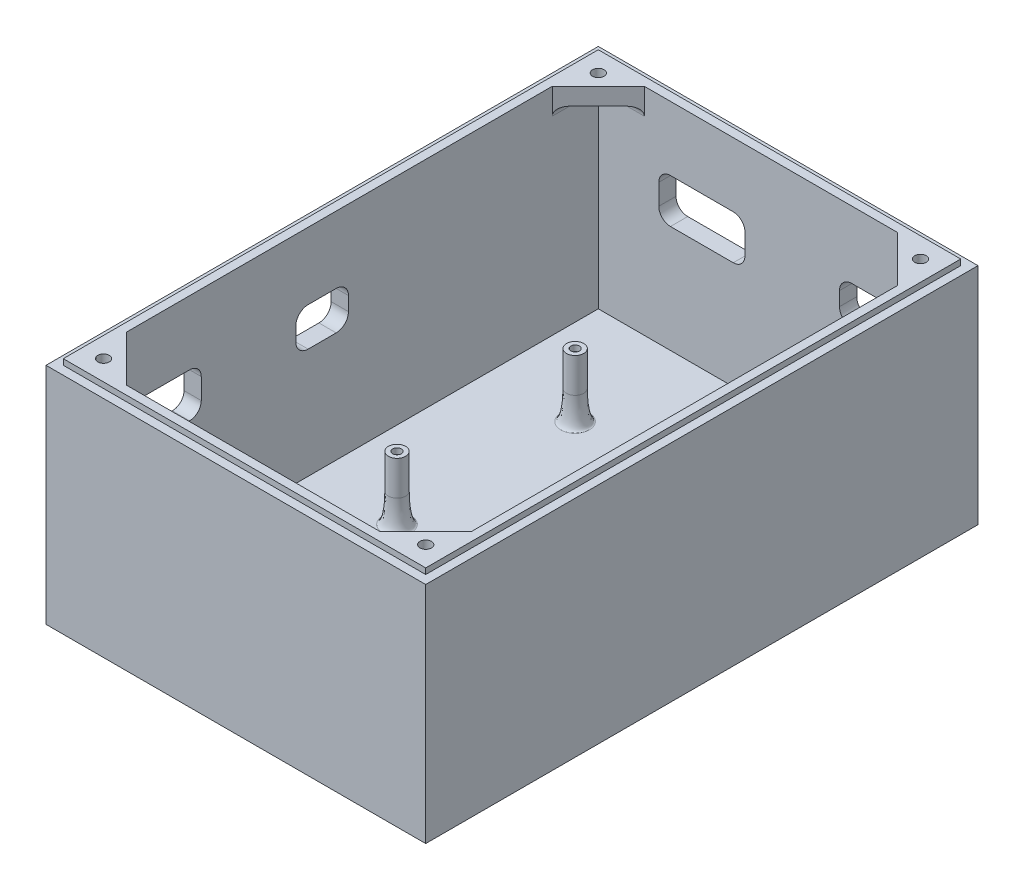
from build123d import *

# Parameters (mm, degrees)
SKETCH1_W           = 132
SKETCH1_H           = 192
SKETCH1_W_2         = 120
SKETCH1_H_2         = 180
BOSS_EXTRUDE1_DEPTH = 80
SKETCH2_W           = 132
SKETCH2_H           = 192
BOSS_EXTRUDE2_DEPTH = 5
CUT_EXTRUDE1_DEPTH  = 6
CUT_EXTRUDE2_DEPTH  = 6
BOSS_EXTRUDE3_DEPTH = 22
FILLET2_SIZE        = 2
FILLET2_SIZE_2      = 10
SKETCH7_W           = 8
SKETCH7_H           = 8
SKETCH7_R           = 2
BOSS_EXTRUDE4_DEPTH = 6
SKETCH9_W           = 132
SKETCH9_H           = 192
SKETCH9_W_2         = 126
SKETCH9_H_2         = 186
CUT_EXTRUDE3_DEPTH  = 2
FILLET5_R           = 3
SKETCH10_R          = 1.5
CUT_EXTRUDE4_DEPTH  = 2


with BuildPart() as part:
    # Sketch1 → Boss-Extrude1 (new body)
    with BuildSketch(Plane(origin=(0, 0, 0), x_dir=(1, 0, 0), z_dir=(0, 1, 0))):
        Rectangle(SKETCH1_W, SKETCH1_H)
        Rectangle(SKETCH1_W_2, SKETCH1_H_2, mode=Mode.SUBTRACT)
    extrude(amount=BOSS_EXTRUDE1_DEPTH)

    # Sketch2 → Boss-Extrude2 (add)
    with BuildSketch(Plane(origin=(0, 0, 0), x_dir=(-1, 0, 0), z_dir=(0, -1, 0))):
        Rectangle(SKETCH2_W, SKETCH2_H)
    extrude(amount=-BOSS_EXTRUDE2_DEPTH)

    # Sketch3 → Cut-Extrude1 (cut)
    with BuildSketch(Plane(origin=(0, 0, -96), x_dir=(-1, 0, 0), z_dir=(0, 0, -1))):
        with BuildLine():
            Line((-37.875, 56.69), (-28.125, 56.69))
            ThreePointArc((-28.125, 56.69), (-25.105654044, 55.439345956), (-23.855, 52.42))
            Line((-23.855, 52.42), (-23.855, 47.58))
            ThreePointArc((-23.855, 47.58), (-25.105654044, 44.560654044), (-28.125, 43.31))
            Line((-28.125, 43.31), (-37.875, 43.31))
            ThreePointArc((-37.875, 43.31), (-40.894345956, 44.560654044), (-42.145, 47.58))
            Line((-42.145, 47.58), (-42.145, 52.42))
            ThreePointArc((-42.145, 52.42), (-40.894345956, 55.439345956), (-37.875, 56.69))
        make_face()
        with BuildLine():
            Line((13.085, 57.67), (34.915, 57.67))
            ThreePointArc((34.915, 57.67), (37.785853532, 56.480853532), (38.975, 53.61))
            Line((38.975, 53.61), (38.975, 46.39))
            ThreePointArc((38.975, 46.39), (37.785853532, 43.519146468), (34.915, 42.33))
            Line((34.915, 42.33), (13.085, 42.33))
            ThreePointArc((13.085, 42.33), (10.214146468, 43.519146468), (9.025, 46.39))
            Line((9.025, 46.39), (9.025, 53.61))
            ThreePointArc((9.025, 53.61), (10.214146468, 56.480853532), (13.085, 57.67))
        make_face()
    extrude(amount=-CUT_EXTRUDE1_DEPTH, mode=Mode.SUBTRACT)

    # Sketch4 → Cut-Extrude2 (cut)
    with BuildSketch(Plane.ZY.offset(66)):
        with BuildLine():
            Line((52.085, 57.67), (73.915, 57.67))
            ThreePointArc((73.915, 57.67), (76.785853532, 56.480853532), (77.975, 53.61))
            Line((77.975, 53.61), (77.975, 46.39))
            ThreePointArc((77.975, 46.39), (76.785853532, 43.519146468), (73.915, 42.33))
            Line((73.915, 42.33), (52.085, 42.33))
            ThreePointArc((52.085, 42.33), (49.214146468, 43.519146468), (48.025, 46.39))
            Line((48.025, 46.39), (48.025, 53.61))
            ThreePointArc((48.025, 53.61), (49.214146468, 56.480853532), (52.085, 57.67))
        make_face()
        with BuildLine():
            Line((1.125, 56.69), (10.875, 56.69))
            ThreePointArc((10.875, 56.69), (13.894345956, 55.439345956), (15.145, 52.42))
            Line((15.145, 52.42), (15.145, 47.58))
            ThreePointArc((15.145, 47.58), (13.894345956, 44.560654044), (10.875, 43.31))
            Line((10.875, 43.31), (1.125, 43.31))
            ThreePointArc((1.125, 43.31), (-1.894345956, 44.560654044), (-3.145, 47.58))
            Line((-3.145, 47.58), (-3.145, 52.42))
            ThreePointArc((-3.145, 52.42), (-1.894345956, 55.439345956), (1.125, 56.69))
        make_face()
    extrude(amount=-CUT_EXTRUDE2_DEPTH, mode=Mode.SUBTRACT)

    # Sketch5 → Boss-Extrude3 (add)
    with BuildSketch(Plane(origin=(0, 5, 0), x_dir=(1, 0, 0), z_dir=(0, 1, 0))):
        with BuildLine():
            ThreePointArc((45.046999695, 52.032000671), (42.046999695, 55.032000671), (39.046999695, 52.032000671))
            Line((39.046999695, 52.032000671), (42.046999695, 52.032000671))
            Line((42.046999695, 52.032000671), (42.046999695, 49.032000671))
            ThreePointArc((42.046999695, 49.032000671), (44.168320038, 49.910680328), (45.046999695, 52.032000671))
        make_face()
        with BuildLine():
            Line((42.046999695, 52.032000671), (39.046999695, 52.032000671))
            ThreePointArc((39.046999695, 52.032000671), (39.925679351, 49.910680328), (42.046999695, 49.032000671))
            Line((42.046999695, 49.032000671), (42.046999695, 52.032000671))
        make_face()
        with BuildLine():
            ThreePointArc((45.046999695, -71.793003906), (44.168320038, -69.671683563), (42.046999695, -68.793003906))
            Line((42.046999695, -68.793003906), (42.046999695, -71.793003906))
            Line((42.046999695, -71.793003906), (39.046999695, -71.793003906))
            ThreePointArc((39.046999695, -71.793003906), (42.046999695, -74.793003906), (45.046999695, -71.793003906))
        make_face()
        with BuildLine():
            Line((42.046999695, -71.793003906), (42.046999695, -68.793003906))
            ThreePointArc((42.046999695, -68.793003906), (39.925679351, -69.671683563), (39.046999695, -71.793003906))
            Line((39.046999695, -71.793003906), (42.046999695, -71.793003906))
        make_face()
        with BuildLine():
            Line((-30.089001892, 49.032000671), (-30.089001892, 52.032000671))
            Line((-30.089001892, 52.032000671), (-27.089001892, 52.032000671))
            ThreePointArc((-27.089001892, 52.032000671), (-32.210322236, 54.153321015), (-30.089001892, 49.032000671))
        make_face()
        with BuildLine():
            Line((-27.089001892, 52.032000671), (-30.089001892, 52.032000671))
            Line((-30.089001892, 52.032000671), (-30.089001892, 49.032000671))
            ThreePointArc((-30.089001892, 49.032000671), (-27.967681549, 49.910680328), (-27.089001892, 52.032000671))
        make_face()
        with BuildLine():
            ThreePointArc((-27.089001892, -71.793003906), (-27.967681549, -69.671683563), (-30.089001892, -68.793003906))
            Line((-30.089001892, -68.793003906), (-30.089001892, -71.793003906))
            Line((-30.089001892, -71.793003906), (-27.089001892, -71.793003906))
        make_face()
        with BuildLine():
            Line((-30.089001892, -71.793003906), (-30.089001892, -68.793003906))
            ThreePointArc((-30.089001892, -68.793003906), (-32.210322236, -73.91432425), (-27.089001892, -71.793003906))
            Line((-27.089001892, -71.793003906), (-30.089001892, -71.793003906))
        make_face()
        with BuildLine():
            ThreePointArc((-27.089001892, -9.880501617), (-27.967681549, -7.759181274), (-30.089001892, -6.880501617))
            Line((-30.089001892, -6.880501617), (-30.089001892, -12.880501617))
            ThreePointArc((-30.089001892, -12.880501617), (-27.967681549, -12.001821961), (-27.089001892, -9.880501617))
        make_face()
        with BuildLine():
            Line((-30.089001892, -12.880501617), (-30.089001892, -6.880501617))
            ThreePointArc((-30.089001892, -6.880501617), (-33.089001892, -9.880501617), (-30.089001892, -12.880501617))
        make_face()
        with BuildLine():
            ThreePointArc((45.046999695, -9.880501617), (44.168320038, -7.759181274), (42.046999695, -6.880501617))
            Line((42.046999695, -6.880501617), (42.046999695, -12.880501617))
            ThreePointArc((42.046999695, -12.880501617), (44.168320038, -12.001821961), (45.046999695, -9.880501617))
        make_face()
        with BuildLine():
            Line((42.046999695, -12.880501617), (42.046999695, -6.880501617))
            ThreePointArc((42.046999695, -6.880501617), (39.046999695, -9.880501617), (42.046999695, -12.880501617))
        make_face()
    extrude(amount=BOSS_EXTRUDE3_DEPTH)

    # Fillet2
    # an asymmetric fillet: 10, 2 mm, written as the material it adds along each edge
    with BuildSketch(Plane(origin=(42.046999695, 5, -52.032000671), x_dir=(-1, 0, 0), z_dir=(0, 0, -1))) as fillet2_piece_1:
        with BuildLine():
            Bezier((3 + FILLET2_SIZE, 0), (3, 0), (3, FILLET2_SIZE_2), weights=[1, 0.707106781, 1])
            Line((3, FILLET2_SIZE_2), (3, 0))
            Line((3, 0), (3 + FILLET2_SIZE, 0))
        make_face()
    revolve(axis=Axis((42.046999695, 5, -52.032000671), (0, 1, 0)))
    with BuildSketch(Plane(origin=(42.046999695, 5, 71.793003906), x_dir=(0, 0, -1), z_dir=(1, 0, 0))) as fillet2_piece_2:
        with BuildLine():
            Bezier((3 + FILLET2_SIZE, 0), (3, 0), (3, FILLET2_SIZE_2), weights=[1, 0.707106781, 1])
            Line((3, FILLET2_SIZE_2), (3, 0))
            Line((3, 0), (3 + FILLET2_SIZE, 0))
        make_face()
    revolve(axis=Axis((42.046999695, 5, 71.793003906), (0, 1, 0)))
    with BuildSketch(Plane(origin=(-30.089001892, 5, -52.032000671), x_dir=(0, 0, 1), z_dir=(-1, 0, 0))) as fillet2_piece_3:
        with BuildLine():
            Bezier((3 + FILLET2_SIZE, 0), (3, 0), (3, FILLET2_SIZE_2), weights=[1, 0.707106781, 1])
            Line((3, FILLET2_SIZE_2), (3, 0))
            Line((3, 0), (3 + FILLET2_SIZE, 0))
        make_face()
    revolve(axis=Axis((-30.089001892, 5, -52.032000671), (0, 1, 0)))
    with BuildSketch(Plane(origin=(-30.089001892, 5, 71.793003906), x_dir=(1, 0, 0), z_dir=(0, 0, 1))) as fillet2_piece_4:
        with BuildLine():
            Bezier((3 + FILLET2_SIZE, 0), (3, 0), (3, FILLET2_SIZE_2), weights=[1, 0.707106781, 1])
            Line((3, FILLET2_SIZE_2), (3, 0))
            Line((3, 0), (3 + FILLET2_SIZE, 0))
        make_face()
    revolve(axis=Axis((-30.089001892, 5, 71.793003906), (0, 1, 0)))
    with BuildSketch(Plane(origin=(-30.089001892, 5, 9.880501617), x_dir=(0, 0, -1), z_dir=(1, 0, 0))) as fillet2_piece_5:
        with BuildLine():
            Bezier((3 + FILLET2_SIZE, 0), (3, 0), (3, FILLET2_SIZE_2), weights=[1, 0.707106781, 1])
            Line((3, FILLET2_SIZE_2), (3, 0))
            Line((3, 0), (3 + FILLET2_SIZE, 0))
        make_face()
    revolve(axis=Axis((-30.089001892, 5, 9.880501617), (0, 1, 0)))
    with BuildSketch(Plane(origin=(42.046999695, 5, 9.880501617), x_dir=(0, 0, -1), z_dir=(1, 0, 0))) as fillet2_piece_6:
        with BuildLine():
            Bezier((3 + FILLET2_SIZE, 0), (3, 0), (3, FILLET2_SIZE_2), weights=[1, 0.707106781, 1])
            Line((3, FILLET2_SIZE_2), (3, 0))
            Line((3, 0), (3 + FILLET2_SIZE, 0))
        make_face()
    revolve(axis=Axis((42.046999695, 5, 9.880501617), (0, 1, 0)))

    # Sketch7 → Boss-Extrude4 (add)
    # profile 1 of 12: a face of its own
    with BuildSketch(Plane(origin=(0, 80, 0), x_dir=(1, 0, 0), z_dir=(0, 1, 0))):
        with Locations((-56, 86)):
            Rectangle(SKETCH7_W, SKETCH7_H)
        with Locations(Location((-56, 86, 0), (0, 0, 270))):
            Circle(SKETCH7_R, mode=Mode.SUBTRACT)
    # profile 2 of 12: a face of its own
    with BuildSketch(Plane(origin=(0, 80, 0), x_dir=(1, 0, 0), z_dir=(0, 1, 0))):
        Polygon((-52, 82), (-60, 82), (-60, 74), align=None)
    # profile 3 of 12: a face of its own
    with BuildSketch(Plane(origin=(0, 80, 0), x_dir=(1, 0, 0), z_dir=(0, 1, 0))):
        Polygon((-44, 90), (-52, 90), (-52, 82), align=None)
    # profile 4 of 12: a face of its own
    with BuildSketch(Plane(origin=(0, 80, 0), x_dir=(1, 0, 0), z_dir=(0, 1, 0))):
        Polygon((52, 90), (44, 90), (52, 82), align=None)
    # profile 5 of 12: a face of its own
    with BuildSketch(Plane(origin=(0, 80, 0), x_dir=(1, 0, 0), z_dir=(0, 1, 0))):
        with Locations((56, 86)):
            Rectangle(SKETCH7_W, SKETCH7_H)
        with Locations(Location((56, 86, 0), (0, 0, 270))):
            Circle(SKETCH7_R, mode=Mode.SUBTRACT)
    # profile 6 of 12: a face of its own
    with BuildSketch(Plane(origin=(0, 80, 0), x_dir=(1, 0, 0), z_dir=(0, 1, 0))):
        Polygon((60, 82), (52, 82), (60, 74), align=None)
    # profile 7 of 12: a face of its own
    with BuildSketch(Plane(origin=(0, 80, 0), x_dir=(1, 0, 0), z_dir=(0, 1, 0))):
        Polygon((52, -82), (44, -90), (52, -90), align=None)
    # profile 8 of 12: a face of its own
    with BuildSketch(Plane(origin=(0, 80, 0), x_dir=(1, 0, 0), z_dir=(0, 1, 0))):
        with Locations((56, -86)):
            Rectangle(SKETCH7_W, SKETCH7_H)
        with Locations(Location((56, -86, 0), (0, 0, 270))):
            Circle(SKETCH7_R, mode=Mode.SUBTRACT)
    # profile 9 of 12: a face of its own
    with BuildSketch(Plane(origin=(0, 80, 0), x_dir=(1, 0, 0), z_dir=(0, 1, 0))):
        Polygon((60, -82), (60, -74), (52, -82), align=None)
    # profile 10 of 12: a face of its own
    with BuildSketch(Plane(origin=(0, 80, 0), x_dir=(1, 0, 0), z_dir=(0, 1, 0))):
        with Locations((-56, -86)):
            Rectangle(SKETCH7_W, SKETCH7_H)
        with Locations(Location((-56, -86, 0), (0, 0, 270))):
            Circle(SKETCH7_R, mode=Mode.SUBTRACT)
    # profile 11 of 12: a face of its own
    with BuildSketch(Plane(origin=(0, 80, 0), x_dir=(1, 0, 0), z_dir=(0, 1, 0))):
        Polygon((-52, -82), (-60, -74), (-60, -82), align=None)
    # profile 12 of 12: a face of its own
    with BuildSketch(Plane(origin=(0, 80, 0), x_dir=(1, 0, 0), z_dir=(0, 1, 0))):
        Polygon((-44, -90), (-52, -82), (-52, -90), align=None)
    extrude(amount=-BOSS_EXTRUDE4_DEPTH)

    # Sketch9 → Cut-Extrude3 (cut)
    with BuildSketch(Plane(origin=(0, 80, 0), x_dir=(1, 0, 0), z_dir=(0, 1, 0))):
        Rectangle(SKETCH9_W, SKETCH9_H)
        Rectangle(SKETCH9_W_2, SKETCH9_H_2, mode=Mode.SUBTRACT)
    extrude(amount=-CUT_EXTRUDE3_DEPTH, mode=Mode.SUBTRACT)

    # Fillet5
    # the kernel refuses this fillet: 3 mm, written as the material it adds along each edge
    with BuildSketch(Plane(origin=(-60, 74, -97.5), x_dir=(0, -1, 0), z_dir=(0, 0, 1))) as fillet5_piece_1_section:
        with BuildLine():
            CenterArc((FILLET5_R, FILLET5_R), FILLET5_R, 180, 90)
            Line((0, FILLET5_R), (0, 0))
            Line((0, 0), (FILLET5_R, 0))
        make_face()
    fillet5_piece_1 = extrude(amount=31, mode=Mode.PRIVATE)
    fillet5_piece_1 = split(fillet5_piece_1, bisect_by=Plane(origin=(-55.521844725, 73.315613579, -78.478155275), z_dir=(-0.7071067811865469, 0, -0.7071067811865481)), keep=Keep.TOP, mode=Mode.PRIVATE)
    fillet5_piece_1 = fillet5_piece_1 - Plane(origin=(-56, 73.315613579, -86), x_dir=(0, 0, 1), z_dir=(0, 1, 0)) * Cylinder(2, 74, mode=Mode.PRIVATE)
    fillet5_piece_1 = split(fillet5_piece_1, bisect_by=Plane(origin=(-59.356140418, 73.315613579, -96), z_dir=(0, 0, 1)), keep=Keep.TOP, mode=Mode.PRIVATE)
    add(fillet5_piece_1)
    with BuildSketch(Plane(origin=(-36.5, 74, -90), x_dir=(0, -1, 0), z_dir=(-1, 0, 0))) as fillet5_piece_2_section:
        with BuildLine():
            CenterArc((FILLET5_R, FILLET5_R), FILLET5_R, 180, 90)
            Line((0, FILLET5_R), (0, 0))
            Line((0, 0), (FILLET5_R, 0))
        make_face()
    fillet5_piece_2 = extrude(amount=31, mode=Mode.PRIVATE)
    fillet5_piece_2 = split(fillet5_piece_2, bisect_by=Plane(origin=(-48.478155288, 73.315613578, -85.521844712), z_dir=(-0.7071067811865469, 0, -0.7071067811865481)), keep=Keep.TOP, mode=Mode.PRIVATE)
    fillet5_piece_2 = fillet5_piece_2 - Plane(origin=(-56, 73.315613578, -86), x_dir=(0, 0, 1), z_dir=(0, 1, 0)) * Cylinder(2, 74, mode=Mode.PRIVATE)
    fillet5_piece_2 = split(fillet5_piece_2, bisect_by=Plane(origin=(-66, 73.315613578, -89.356140422), z_dir=(1, 0, 0)), keep=Keep.TOP, mode=Mode.PRIVATE)
    add(fillet5_piece_2)
    with BuildSketch(Plane(origin=(67.5, 74, -90), x_dir=(0, -1, 0), z_dir=(-1, 0, 0))) as fillet5_piece_3_section:
        with BuildLine():
            CenterArc((FILLET5_R, FILLET5_R), FILLET5_R, 180, 90)
            Line((0, FILLET5_R), (0, 0))
            Line((0, 0), (FILLET5_R, 0))
        make_face()
    fillet5_piece_3 = extrude(amount=31, mode=Mode.PRIVATE)
    fillet5_piece_3 = split(fillet5_piece_3, bisect_by=Plane(origin=(48.478155275, 73.315613579, -85.521844725), z_dir=(0.7071067811865469, 0, -0.7071067811865481)), keep=Keep.TOP, mode=Mode.PRIVATE)
    fillet5_piece_3 = fillet5_piece_3 - Plane(origin=(56, 73.315613579, -86), x_dir=(0, 0, 1), z_dir=(0, 1, 0)) * Cylinder(2, 74, mode=Mode.PRIVATE)
    fillet5_piece_3 = split(fillet5_piece_3, bisect_by=Plane(origin=(66, 73.315613579, -89.356140418), z_dir=(-1, 0, 0)), keep=Keep.TOP, mode=Mode.PRIVATE)
    add(fillet5_piece_3)
    with BuildSketch(Plane(origin=(60, 74, -66.5), x_dir=(0, -1, 0), z_dir=(0, 0, -1))) as fillet5_piece_4_section:
        with BuildLine():
            CenterArc((FILLET5_R, FILLET5_R), FILLET5_R, 180, 90)
            Line((0, FILLET5_R), (0, 0))
            Line((0, 0), (FILLET5_R, 0))
        make_face()
    fillet5_piece_4 = extrude(amount=31, mode=Mode.PRIVATE)
    fillet5_piece_4 = split(fillet5_piece_4, bisect_by=Plane(origin=(55.521844712, 73.315613578, -78.478155288), z_dir=(0.7071067811865469, 0, -0.7071067811865481)), keep=Keep.TOP, mode=Mode.PRIVATE)
    fillet5_piece_4 = fillet5_piece_4 - Plane(origin=(56, 73.315613578, -86), x_dir=(0, 0, 1), z_dir=(0, 1, 0)) * Cylinder(2, 74, mode=Mode.PRIVATE)
    fillet5_piece_4 = split(fillet5_piece_4, bisect_by=Plane(origin=(59.356140422, 73.315613578, -96), z_dir=(0, 0, 1)), keep=Keep.TOP, mode=Mode.PRIVATE)
    add(fillet5_piece_4)
    with BuildSketch(Plane(origin=(60, 74, 66.5), x_dir=(0, -1, 0), z_dir=(0, 0, 1))) as fillet5_piece_5_section:
        with BuildLine():
            CenterArc((FILLET5_R, -FILLET5_R), FILLET5_R, 90, 90)
            Line((0, -FILLET5_R), (0, 0))
            Line((0, 0), (FILLET5_R, 0))
        make_face()
    fillet5_piece_5 = extrude(amount=31, mode=Mode.PRIVATE)
    fillet5_piece_5 = split(fillet5_piece_5, bisect_by=Plane(origin=(55.521844725, 73.315613579, 78.478155275), z_dir=(0.7071067811865469, 0, 0.7071067811865481)), keep=Keep.TOP, mode=Mode.PRIVATE)
    fillet5_piece_5 = fillet5_piece_5 - Plane(origin=(56, 73.315613579, 86), x_dir=(0, 0, 1), z_dir=(0, 1, 0)) * Cylinder(2, 74, mode=Mode.PRIVATE)
    fillet5_piece_5 = split(fillet5_piece_5, bisect_by=Plane(origin=(59.356140418, 73.315613579, 96), z_dir=(0, 0, -1)), keep=Keep.TOP, mode=Mode.PRIVATE)
    add(fillet5_piece_5)
    with BuildSketch(Plane(origin=(36.5, 74, 90), x_dir=(0, -1, 0), z_dir=(1, 0, 0))) as fillet5_piece_6_section:
        with BuildLine():
            CenterArc((FILLET5_R, FILLET5_R), FILLET5_R, 180, 90)
            Line((0, FILLET5_R), (0, 0))
            Line((0, 0), (FILLET5_R, 0))
        make_face()
    fillet5_piece_6 = extrude(amount=31, mode=Mode.PRIVATE)
    fillet5_piece_6 = split(fillet5_piece_6, bisect_by=Plane(origin=(48.478155431, 73.315613506, 85.521844569), z_dir=(0.7071067811865469, 0, 0.7071067811865481)), keep=Keep.TOP, mode=Mode.PRIVATE)
    fillet5_piece_6 = fillet5_piece_6 - Plane(origin=(56, 73.315613506, 86), x_dir=(0, 0, 1), z_dir=(0, 1, 0)) * Cylinder(2, 74, mode=Mode.PRIVATE)
    fillet5_piece_6 = split(fillet5_piece_6, bisect_by=Plane(origin=(66, 73.315613506, 89.35614041), z_dir=(-1, 0, 0)), keep=Keep.TOP, mode=Mode.PRIVATE)
    add(fillet5_piece_6)
    with BuildSketch(Plane(origin=(-36.5, 74, 90), x_dir=(0, -1, 0), z_dir=(-1, 0, 0))) as fillet5_piece_7_section:
        with BuildLine():
            CenterArc((FILLET5_R, -FILLET5_R), FILLET5_R, 90, 90)
            Line((0, -FILLET5_R), (0, 0))
            Line((0, 0), (FILLET5_R, 0))
        make_face()
    fillet5_piece_7 = extrude(amount=31, mode=Mode.PRIVATE)
    fillet5_piece_7 = split(fillet5_piece_7, bisect_by=Plane(origin=(-48.478155405, 73.315613503, 85.521844595), z_dir=(-0.7071067811865476, 0, 0.7071067811865476)), keep=Keep.TOP, mode=Mode.PRIVATE)
    fillet5_piece_7 = fillet5_piece_7 - Plane(origin=(-56, 73.315613503, 86), x_dir=(0, 0, 1), z_dir=(0, 1, 0)) * Cylinder(2, 74, mode=Mode.PRIVATE)
    fillet5_piece_7 = split(fillet5_piece_7, bisect_by=Plane(origin=(-66, 73.315613503, 89.356140417), z_dir=(1, 0, 0)), keep=Keep.TOP, mode=Mode.PRIVATE)
    add(fillet5_piece_7)
    with BuildSketch(Plane(origin=(-60, 74, 97.5), x_dir=(0, -1, 0), z_dir=(0, 0, -1))) as fillet5_piece_8_section:
        with BuildLine():
            CenterArc((FILLET5_R, -FILLET5_R), FILLET5_R, 90, 90)
            Line((0, -FILLET5_R), (0, 0))
            Line((0, 0), (FILLET5_R, 0))
        make_face()
    fillet5_piece_8 = extrude(amount=31, mode=Mode.PRIVATE)
    fillet5_piece_8 = split(fillet5_piece_8, bisect_by=Plane(origin=(-55.521844712, 73.315613578, 78.478155288), z_dir=(-0.7071067811865476, 0, 0.7071067811865476)), keep=Keep.TOP, mode=Mode.PRIVATE)
    fillet5_piece_8 = fillet5_piece_8 - Plane(origin=(-56, 73.315613578, 86), x_dir=(0, 0, 1), z_dir=(0, 1, 0)) * Cylinder(2, 74, mode=Mode.PRIVATE)
    fillet5_piece_8 = split(fillet5_piece_8, bisect_by=Plane(origin=(-59.356140422, 73.315613578, 96), z_dir=(0, 0, -1)), keep=Keep.TOP, mode=Mode.PRIVATE)
    add(fillet5_piece_8)

    # Sketch10 → Cut-Extrude4 (cut)
    with BuildSketch(Plane(origin=(0, 27, 0), x_dir=(1, 0, 0), z_dir=(0, 1, 0))):
        with Locations(Location((-30.089001892, 52.032000671, 0), (0, 0, 270))):
            Circle(SKETCH10_R)
        with Locations(Location((42.046999695, 52.032000671, 0), (0, 0, 270))):
            Circle(SKETCH10_R)
        with Locations(Location((42.046999695, -9.880501617, 0), (0, 0, 270))):
            Circle(SKETCH10_R)
        with Locations(Location((42.046999695, -71.793003906, 0), (0, 0, 270))):
            Circle(SKETCH10_R)
        with Locations(Location((-30.089001892, -71.793003906, 0), (0, 0, 270))):
            Circle(SKETCH10_R)
        with Locations(Location((-30.089001892, -9.880501617, 0), (0, 0, 270))):
            Circle(SKETCH10_R)
    extrude(amount=-CUT_EXTRUDE4_DEPTH, mode=Mode.SUBTRACT)


solid = part.part
